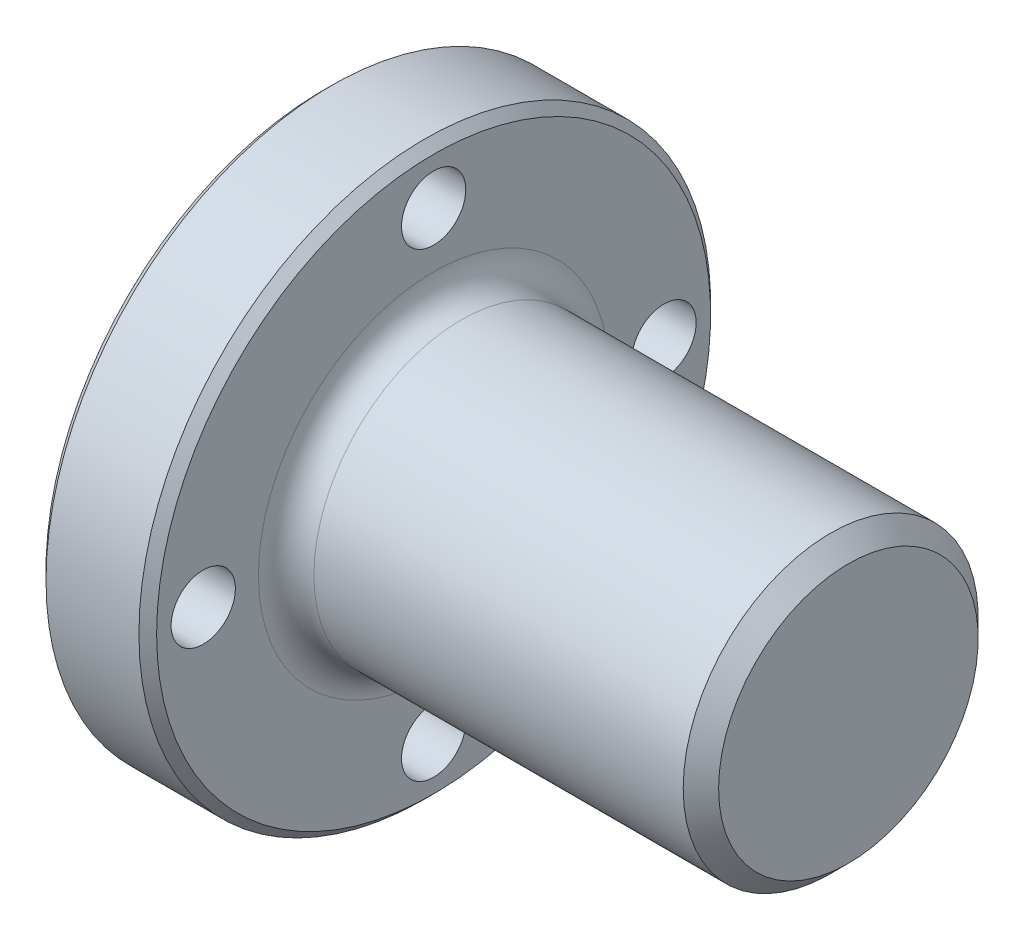
from build123d import *

# Parameters (mm, degrees)
FILLET1_R          = 2.3876
CHAMFER1_SIZE      = 0.762
CHAMFER2_SIZE      = 1.524
CUT_EXTRUDE2_START = 14.351
SKETCH2_R          = 2.7686
CUT_EXTRUDE2_DEPTH = 76.325619122
CUT_EXTRUDE4_START = 14.351
SKETCH3_R          = 2.7686
CUT_EXTRUDE4_DEPTH = 76.325619122


with BuildPart() as part:
    # Sketch1 → Revolve1 (revolve)
    with BuildSketch(Plane(origin=(0, 0, 0), x_dir=(0, 1, 0), z_dir=(0, 0, 1))):
        Polygon((0, 0), (8.7122, 0), (8.7122, -4.826), (24.6126, -4.826), (24.6126, -14.351), (12.7, -14.351), (12.7, -50.0634), (0, -50.0634), align=None)
    revolve(axis=Axis((-25.4, 0, 0), (1, 0, 0)))

    # Fillet1
    fillet1_edges = [part.edges().sort_by_distance(p)[0] for p in [
        (14.351, -12.7, 0),
    ]]
    fillet(fillet1_edges, radius=FILLET1_R)

    # Chamfer1
    chamfer1_edges = [part.edges().sort_by_distance(p)[0] for p in [
        (14.351, -24.6126, 0),
        (4.826, -24.6126, 0),
        (0, -8.7122, 0),
    ]]
    chamfer(chamfer1_edges, length=CHAMFER1_SIZE)

    # Chamfer2
    chamfer2_edges = [part.edges().sort_by_distance(p)[0] for p in [
        (50.0634, -12.7, 0),
    ]]
    chamfer(chamfer2_edges, length=CHAMFER2_SIZE)

    # Sketch2 → Cut-Extrude2 (cut, through all)
    with BuildSketch(Plane.YZ.offset(CUT_EXTRUDE2_START)):
        with Locations((19.8374, 0)):
            Circle(SKETCH2_R)
    extrude(amount=-CUT_EXTRUDE2_DEPTH, mode=Mode.SUBTRACT)

    # Sketch3 → Cut-Extrude4 (cut, through all)
    with BuildSketch(Plane.YZ.offset(CUT_EXTRUDE4_START)):
        with Locations((0, 19.8374)):
            Circle(SKETCH3_R)
        with Locations((-19.8374, 0)):
            Circle(SKETCH3_R)
        with Locations((0, -19.8374)):
            Circle(SKETCH3_R)
    extrude(amount=-CUT_EXTRUDE4_DEPTH, mode=Mode.SUBTRACT)


solid = part.part
